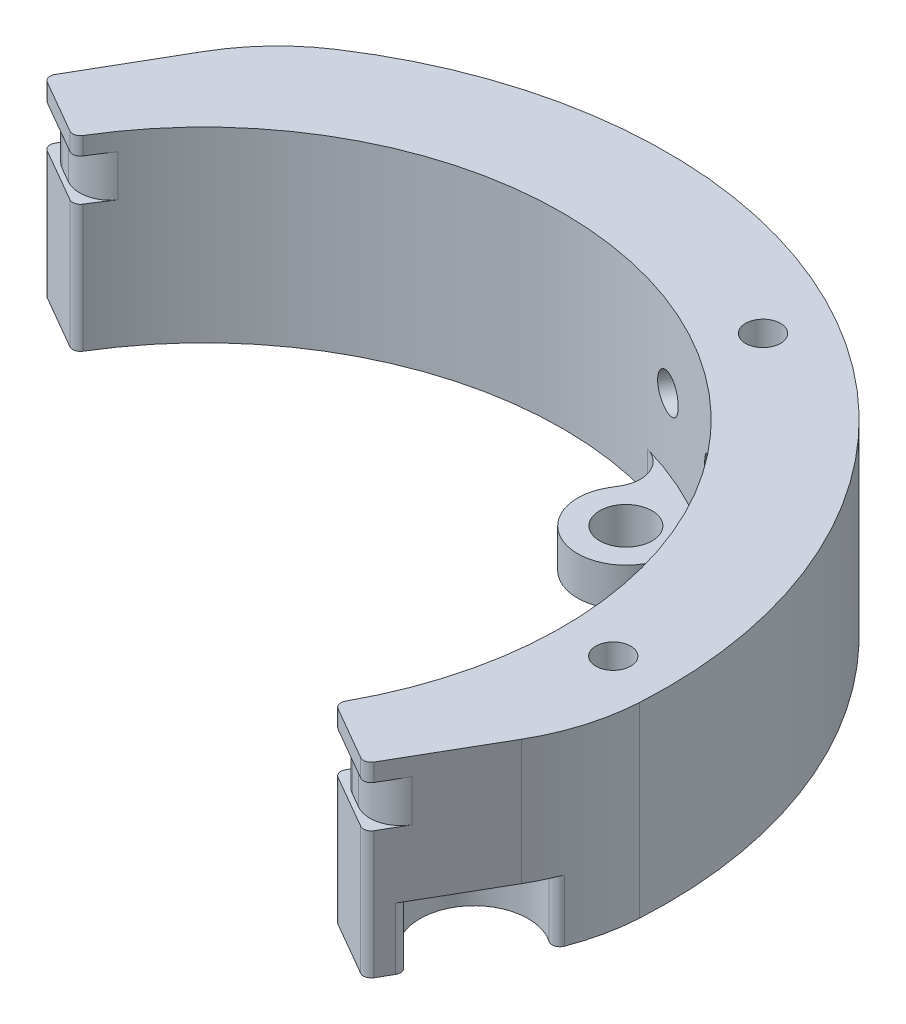
from build123d import *

# Parameters (mm, degrees)
BOSS_EXTRUDE1_DEPTH                        = 15.367
BOSS_EXTRUDE2_DEPTH                        = 3.175
F_8_CLEARANCE_HOLE1_D                      = 4.3053
SKETCH10_R                                 = 4.445
CUT_EXTRUDE2_DEPTH                         = 5.08
FILLET3_R                                  = 2.54
SKETCH12_W                                 = 0.381
SKETCH12_H                                 = 3.429
CUT_EXTRUDE5_DEPTH                         = 80.383868095
FILLET6_R                                  = 2.54
CBORE_START                                = -39
CBORE_FOR_4_SOCKET_HEAD_CAP_SCREW1_OUTL_R  = 2.77876
CBORE_FOR_4_SOCKET_HEAD_CAP_SCREW1_DEPTH   = 4.004980035
CBORE_START_2                              = -34.995019965
CBORE_FOR_4_SOCKET_HEAD_CAP_SCREW1_2_OU_R  = 1.4732
CBORE_FOR_4_SOCKET_HEAD_CAP_SCREW1_2_DEPTH = 6.995019965
CUT_EXTRUDE6_REACH                         = 58.03
SKETCH17_R                                 = 1.4351
FILLET7_R                                  = 0.635
CUT_EXTRUDE7_DEPTH                         = 61.777907815


with BuildPart() as part:
    # Sketch1 → Boss-Extrude1 (new body)
    with BuildSketch(Plane(origin=(0, 0, 0), x_dir=(1, 0, 0), z_dir=(0, 1, 0))):
        with BuildLine():
            Line((-35.805540197, 9.673815643), (-31.043040197, 17.922707614))
            Line((-31.043040197, 17.922707614), (-25.543778883, 14.747707614))
            ThreePointArc((-25.543778883, 14.747707614), (-14.747707614, -25.543778883), (25.543778883, -14.747707614))
            Line((25.543778883, -14.747707614), (31.043040197, -17.922707614))
            Line((31.043040197, -17.922707614), (26.280540197, -26.171599585))
            ThreePointArc((26.280540197, -26.171599585), (23.947229931, -29.306716595), (20.954526486, -31.820085162))
            ThreePointArc((20.954526486, -31.820085162), (-19.05, -32.995567884), (-38.034265344, 2.23710968))
            ThreePointArc((-38.034265344, 2.23710968), (-37.353976038, 6.085551173), (-35.805540197, 9.673815643))
        make_face()
    extrude(amount=BOSS_EXTRUDE1_DEPTH)

    # Sketch8 → Boss-Extrude2 (add)
    with BuildSketch(Plane(origin=(0, 0, 0), x_dir=(1, 0, 0), z_dir=(0, 1, 0))):
        with BuildLine():
            Line((-9.262961679, -23.981420256), (-11.176555889, -27.295862653))
            ThreePointArc((-11.176555889, -27.295862653), (-14.747707614, -25.543778883), (-18.050632531, -23.327112653))
            Line((-18.050632531, -23.327112653), (-16.137038321, -20.012670256))
            ThreePointArc((-16.137038321, -20.012670256), (-10.715625, -18.560006935), (-9.262961679, -23.981420256))
        make_face()
        with BuildLine():
            Line((3.96875, -25.4), (3.96875, -29.22718842))
            ThreePointArc((3.96875, -29.22718842), (0, -29.495415229), (-3.96875, -29.22718842))
            Line((-3.96875, -29.22718842), (-3.96875, -25.4))
            ThreePointArc((-3.96875, -25.4), (0, -21.43125), (3.96875, -25.4))
        make_face()
    extrude(amount=BOSS_EXTRUDE2_DEPTH)

    # #8 Clearance Hole1 (through all)
    with Locations(Plane(origin=(0, 3.175, 0), x_dir=(1, 0, 0), z_dir=(0, 1, 0))):
        with Locations((0, -25.4), (-12.7, -21.997045256)):
            Hole(F_8_CLEARANCE_HOLE1_D / 2)

    # Sketch10 → Cut-Extrude2 (cut)
    with BuildSketch(Plane.XZ):
        with Locations((-26.502210802, 23.360731753)):
            Circle(SKETCH10_R)
        with Locations((26.502210802, 23.360731753)):
            Circle(SKETCH10_R)
    extrude(amount=-CUT_EXTRUDE2_DEPTH, mode=Mode.SUBTRACT)

    # Fillet3
    fillet3_edges = [part.edges().sort_by_distance(p)[0] for p in [
        (-18.050632531, 1.5875, 23.327112653),
        (-11.176555889, 1.5875, 27.295862653),
        (-3.96875, 1.5875, 29.22718842),
        (3.96875, 1.5875, 29.22718842),
        (-30.836833913, 2.54, 22.376319497),
        (-26.069605371, 2.54, 27.784630208),
    ]]
    fillet(fillet3_edges, radius=FILLET3_R)

    # Sketch12 → Cut-Extrude5 (cut, through all)
    with BuildSketch(Plane(origin=(31.043040197, 0, 17.922707614), x_dir=(0.5000000000000004, 0, -0.8660254037844384), z_dir=(0.8660254037844384, 0, 0.5000000000000004))):
        with Locations((-0.1905, 12.192)):
            Rectangle(SKETCH12_W, SKETCH12_H)
    extrude(amount=-CUT_EXTRUDE5_DEPTH, mode=Mode.SUBTRACT)

    # Fillet6
    fillet6_edges = [part.edges().sort_by_distance(p)[0] for p in [
        (-25.732147733, 12.192, -14.416521515),
        (25.351147733, 12.192, 15.076432873),
        (-31.233540197, 12.192, -17.592751936),
        (30.852540197, 12.192, 18.252663293),
    ]]
    fillet(fillet6_edges, radius=FILLET6_R)

    # CBORE for #4 Socket Head Cap Screw1: read off the stored shape, not the designer's step
    # CBORE for #4 Socket Head Cap Screw1 outl → CBORE for #4 Socket Head Cap Screw1 (cut)
    with BuildSketch(Plane(origin=(0, 0, 0), x_dir=(0.8660254037844374, 0, 0.5000000000000022), z_dir=(0.5000000000000022, 0, -0.8660254037844374)).offset(CBORE_START)):
        with Locations((4.445, -8.89)):
            Circle(CBORE_FOR_4_SOCKET_HEAD_CAP_SCREW1_OUTL_R)
        with Locations((-4.445, -8.89)):
            Circle(CBORE_FOR_4_SOCKET_HEAD_CAP_SCREW1_OUTL_R)
    extrude(amount=CBORE_FOR_4_SOCKET_HEAD_CAP_SCREW1_DEPTH, mode=Mode.SUBTRACT)

    # CBORE for _4 Socket Head Cap Screw1 2 ou → CBORE for _4 Socket Head Cap Screw1 2 (cut)
    with BuildSketch(Plane(origin=(0, 0, 0), x_dir=(0.8660254037844374, 0, 0.5000000000000022), z_dir=(0.5000000000000022, 0, -0.8660254037844374)).offset(CBORE_START_2)):
        with Locations((4.445, -8.89)):
            Circle(CBORE_FOR_4_SOCKET_HEAD_CAP_SCREW1_2_OU_R)
        with Locations((-4.445, -8.89)):
            Circle(CBORE_FOR_4_SOCKET_HEAD_CAP_SCREW1_2_OU_R)
    extrude(amount=CBORE_FOR_4_SOCKET_HEAD_CAP_SCREW1_2_DEPTH, mode=Mode.SUBTRACT)

    # Sketch17 → Cut-Extrude6 (cut, up to next)
    with BuildSketch(Plane(origin=(0, 15.367, 0), x_dir=(1, 0, 0), z_dir=(0, 1, 0)), mode=Mode.PRIVATE) as cut_extrude6_sk1:
        with Locations(Location((-16.8275, -29.146084964, 0), (0, 0, 270))):
            Circle(SKETCH17_R)
    cut_extrude6_tool1 = extrude(cut_extrude6_sk1.sketch, amount=-CUT_EXTRUDE6_REACH, mode=Mode.PRIVATE) & part.part
    # Sketch17 → Cut-Extrude6 (cut, up to next)
    with BuildSketch(Plane(origin=(0, 15.367, 0), x_dir=(1, 0, 0), z_dir=(0, 1, 0)), mode=Mode.PRIVATE) as cut_extrude6_sk2:
        with Locations(Location((16.8275, -29.146084964, 0), (0, 0, 270))):
            Circle(SKETCH17_R)
    cut_extrude6_tool2 = extrude(cut_extrude6_sk2.sketch, amount=-CUT_EXTRUDE6_REACH, mode=Mode.PRIVATE) & part.part
    add(cut_extrude6_tool1.solids().sort_by_distance((-16.8275, 15.367, 29.146085))[0], mode=Mode.SUBTRACT)
    add(cut_extrude6_tool2.solids().sort_by_distance((16.8275, 15.367, 29.146085))[0], mode=Mode.SUBTRACT)

    # Fillet7
    fillet7_edges = [part.edges().sort_by_distance(p)[0] for p in [
        (25.543778883, 5.23875, 14.747707614),
        (31.043040197, 5.23875, 17.922707614),
        (25.543778883, 14.63675, 14.747707614),
        (31.043040197, 14.63675, 17.922707614),
        (-31.043040197, 5.23875, -17.922707614),
        (-25.543778883, 5.23875, -14.747707614),
        (-31.043040197, 14.63675, -17.922707614),
        (-25.543778883, 14.63675, -14.747707614),
        (25.323084778, 2.54, 27.646485691),
        (29.691178841, 2.54, 20.264200169),
    ]]
    fillet(fillet7_edges, radius=FILLET7_R)


with BuildPart() as body_2:
    # Mirror4: mirrored copy
    add(part.part.mirror(Plane(origin=(1.27, 0, -2.199704526), x_dir=(0.8660254037844389, 0, 0.49999999999999944), z_dir=(0.49999999999999967, 0, -0.8660254037844389))))


with BuildPart() as part_1:
    add(part.part)

    # Sketch18 → Cut-Extrude7 (cut, through all)
    with BuildSketch(Plane(origin=(0, 15.367, 0), x_dir=(1, 0, 0), z_dir=(0, 1, 0))):
        Polygon((-35.598010153, 20.561277362), (38.427739113, -19.56618359), (10.396462238, -40.426668706), (-26.181818955, -37.529379107), (-44.652040151, -8.121889672), align=None)
    extrude(amount=-CUT_EXTRUDE7_DEPTH, mode=Mode.SUBTRACT)


solid = body_2.part
